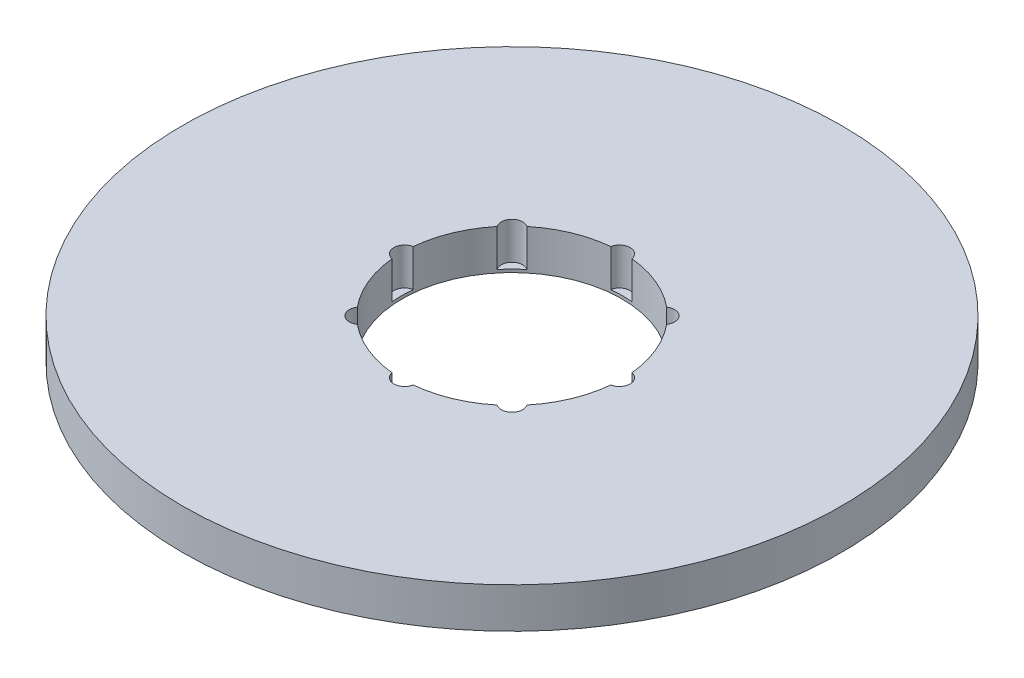
from build123d import *

# Parameters (mm, degrees)
SKETCH1_R           = 90
BOSS_EXTRUDE1_DEPTH = 11
SKETCH2_R           = 30
CUT_EXTRUDE1_DEPTH  = 128.753669223
SKETCH3_R           = 2.926934744
CUT_EXTRUDE2_DEPTH  = 10.173108492
CIRPATTERN1_COUNT   = 8


with BuildPart() as part:
    # Sketch1 → Boss-Extrude1 (new body)
    with BuildSketch(Plane(origin=(0, 0, 0), x_dir=(1, 0, 0), z_dir=(0, 1, 0))):
        Circle(SKETCH1_R)
    extrude(amount=BOSS_EXTRUDE1_DEPTH)

    # Sketch2 → Cut-Extrude1 (cut, through all)
    with BuildSketch(Plane(origin=(0, 0, 0), x_dir=(1, 0, 0), z_dir=(0, 1, 0))):
        Circle(SKETCH2_R)
    extrude(amount=CUT_EXTRUDE1_DEPTH, mode=Mode.SUBTRACT)

    # Sketch3 → Cut-Extrude2 (cut)
    with BuildSketch(Plane(origin=(0, 11, 0), x_dir=(1, 0, 0), z_dir=(0, 1, 0))):
        with Locations((-29.336909485, 0)):
            Circle(SKETCH3_R)
    cut_extrude2 = extrude(amount=-CUT_EXTRUDE2_DEPTH, mode=Mode.SUBTRACT)

    # CirPattern1: Cut-Extrude2 ×8 about axis
    cirpattern1_axis = Axis((0, 0, 0), (0, 1, 0))
    for i in range(1, CIRPATTERN1_COUNT):
        add(cut_extrude2.rotate(cirpattern1_axis, i * 360 / CIRPATTERN1_COUNT), mode=Mode.SUBTRACT)


solid = part.part
